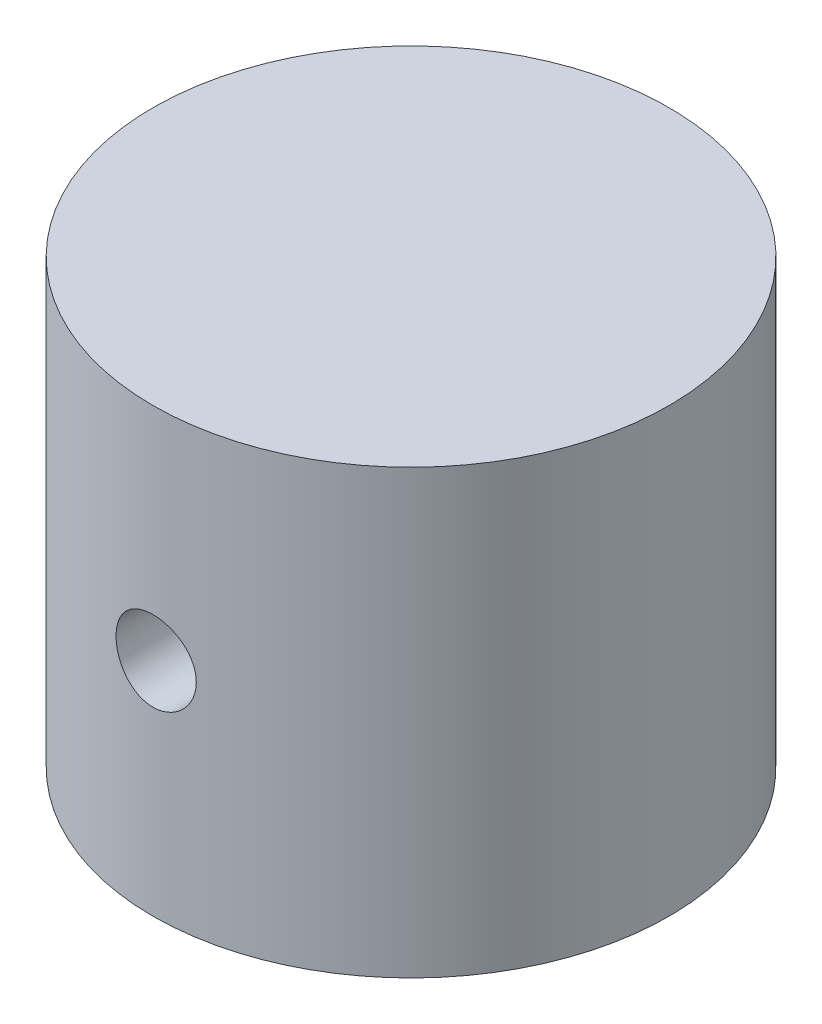
from build123d import *

# Parameters (mm, degrees)
SKETCH1_R           = 11.1125
BOSS_EXTRUDE1_DEPTH = 19.05
SKETCH2_R           = 1.7272
CUT_EXTRUDE1_DEPTH  = 25.695704333


with BuildPart() as part:
    # Sketch1 → Boss-Extrude1 (new body)
    with BuildSketch(Plane(origin=(0, 0, 0), x_dir=(1, 0, 0), z_dir=(0, 1, 0))):
        Circle(SKETCH1_R)
    extrude(amount=BOSS_EXTRUDE1_DEPTH)

    # Sketch2 → Cut-Extrude1 (cut, through all)
    with BuildSketch(Plane.XY):
        with Locations((0, 9.525)):
            Circle(SKETCH2_R)
    extrude(amount=CUT_EXTRUDE1_DEPTH, mode=Mode.SUBTRACT)


solid = part.part
